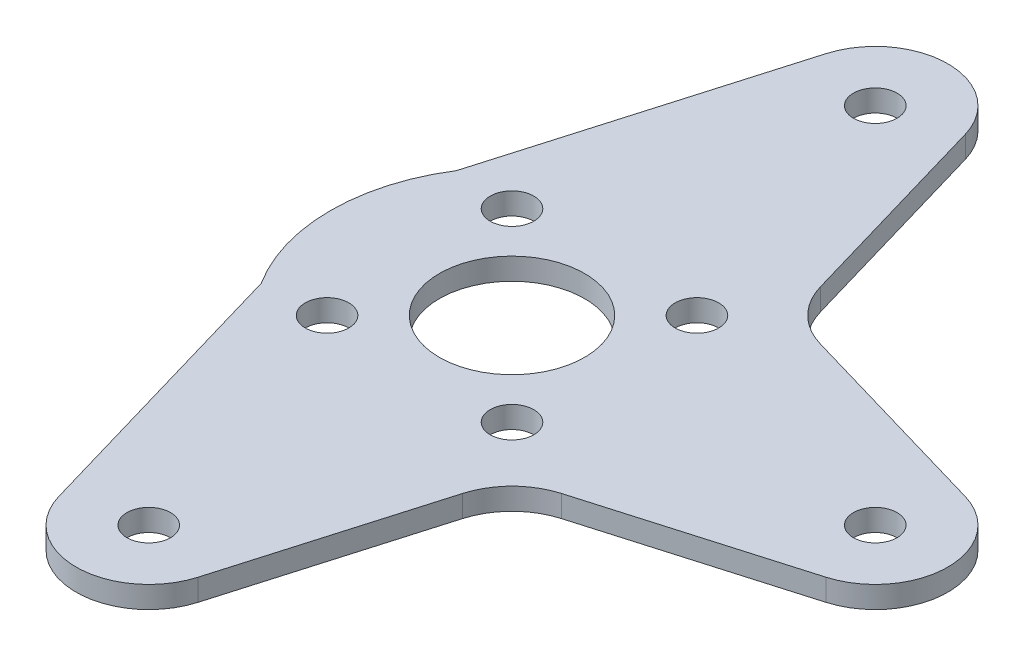
from build123d import *

# Parameters (mm, degrees)
SZKIC1_R                    = 3
SZKIC1_R_2                  = 10
DODANIE_WYCI_GNI_CIE1_DEPTH = 3


with BuildPart() as part:
    # Szkic1 → Dodanie-wyciągnięcie1 (new body)
    with BuildSketch(Plane(origin=(0, 0, 0), x_dir=(1, 0, 0), z_dir=(0, 1, 0))):
        with BuildLine():
            Line((9.6, -52.8), (17.819354839, -24.619354839))
            ThreePointArc((17.819354839, -24.619354839), (20.348287027, -20.348287027), (24.619354839, -17.819354839))
            Line((24.619354839, -17.819354839), (52.8, -9.6))
            ThreePointArc((52.8, -9.6), (60, 0), (52.8, 9.6))
            Line((52.8, 9.6), (24.619354839, 17.819354839))
            ThreePointArc((24.619354839, 17.819354839), (20.348287027, 20.348287027), (17.819354839, 24.619354839))
            Line((17.819354839, 24.619354839), (9.6, 52.8))
            ThreePointArc((9.6, 52.8), (0, 60), (-9.6, 52.8))
            Line((-9.6, 52.8), (-21.08, 13.44))
            ThreePointArc((-21.08, 13.44), (-25, 0), (-21.08, -13.44))
            Line((-21.08, -13.44), (-9.6, -52.8))
            ThreePointArc((-9.6, -52.8), (0, -60), (9.6, -52.8))
        make_face()
        with Locations((0, -50)):
            Circle(SZKIC1_R, mode=Mode.SUBTRACT)
        with Locations((-12.727922061, -12.727922061)):
            Circle(SZKIC1_R, mode=Mode.SUBTRACT)
        with Locations((12.727922061, -12.727922061)):
            Circle(SZKIC1_R, mode=Mode.SUBTRACT)
        with Locations((-12.727922061, 12.727922061)):
            Circle(SZKIC1_R, mode=Mode.SUBTRACT)
        Circle(SZKIC1_R_2, mode=Mode.SUBTRACT)
        with Locations((12.727922061, 12.727922061)):
            Circle(SZKIC1_R, mode=Mode.SUBTRACT)
        with Locations((0, 50)):
            Circle(SZKIC1_R, mode=Mode.SUBTRACT)
        with Locations((50, 0)):
            Circle(SZKIC1_R, mode=Mode.SUBTRACT)
    extrude(amount=DODANIE_WYCI_GNI_CIE1_DEPTH)


solid = part.part
